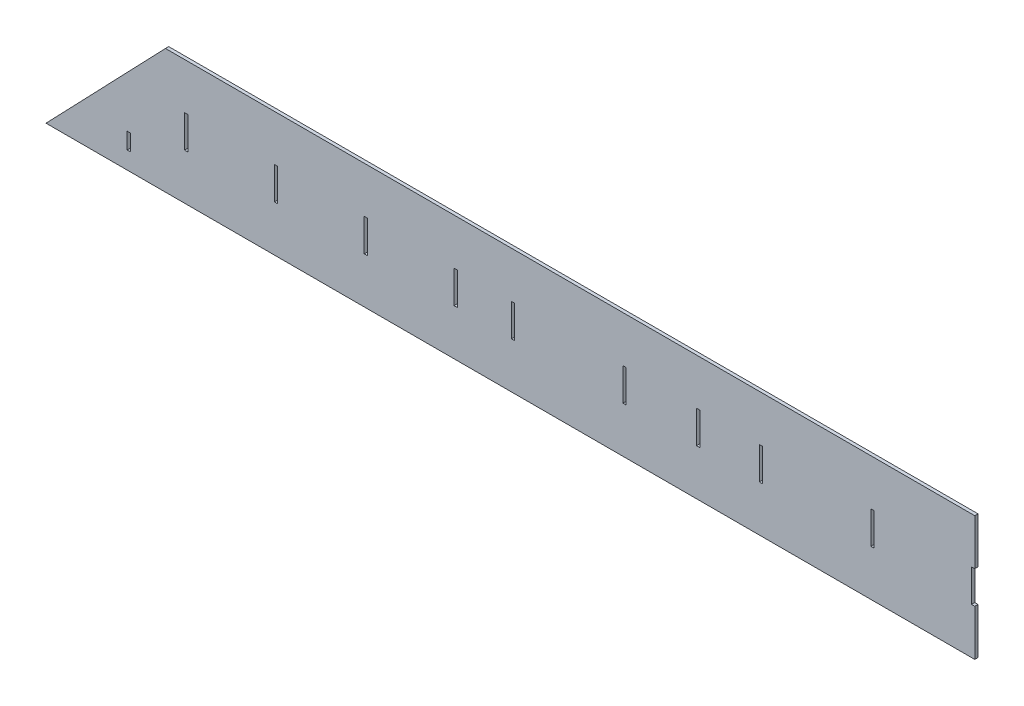
from build123d import *

# Parameters (mm, degrees)
SKETCH1_W           = 3
SKETCH1_H           = 30
SKETCH1_H_2         = 15
BOSS_EXTRUDE1_DEPTH = 3


with BuildPart() as part:
    # Sketch1 → Boss-Extrude1 (new body)
    with BuildSketch(Plane.XY):
        Polygon((0, 0), (110.35106383, 115), (858, 115), (858, 72.5), (855, 72.5), (855, 42.5), (858, 42.5), (858, 0), align=None)
        with Locations((129.5, 57.5)):
            Rectangle(SKETCH1_W, SKETCH1_H, mode=Mode.SUBTRACT)
        with Locations((76.5, 23.609115303)):
            Rectangle(SKETCH1_W, SKETCH1_H_2, mode=Mode.SUBTRACT)
        with Locations((212.5, 57.5)):
            Rectangle(SKETCH1_W, SKETCH1_H, mode=Mode.SUBTRACT)
        with Locations((295.5, 57.5)):
            Rectangle(SKETCH1_W, SKETCH1_H, mode=Mode.SUBTRACT)
        with Locations((378.5, 57.5)):
            Rectangle(SKETCH1_W, SKETCH1_H, mode=Mode.SUBTRACT)
        with Locations((431.5, 57.5)):
            Rectangle(SKETCH1_W, SKETCH1_H, mode=Mode.SUBTRACT)
        with Locations((534.5, 57.5)):
            Rectangle(SKETCH1_W, SKETCH1_H, mode=Mode.SUBTRACT)
        with Locations((602.5, 57.5)):
            Rectangle(SKETCH1_W, SKETCH1_H, mode=Mode.SUBTRACT)
        with Locations((660.5, 57.5)):
            Rectangle(SKETCH1_W, SKETCH1_H, mode=Mode.SUBTRACT)
        with Locations((763.5, 57.5)):
            Rectangle(SKETCH1_W, SKETCH1_H, mode=Mode.SUBTRACT)
    extrude(amount=BOSS_EXTRUDE1_DEPTH)


solid = part.part
